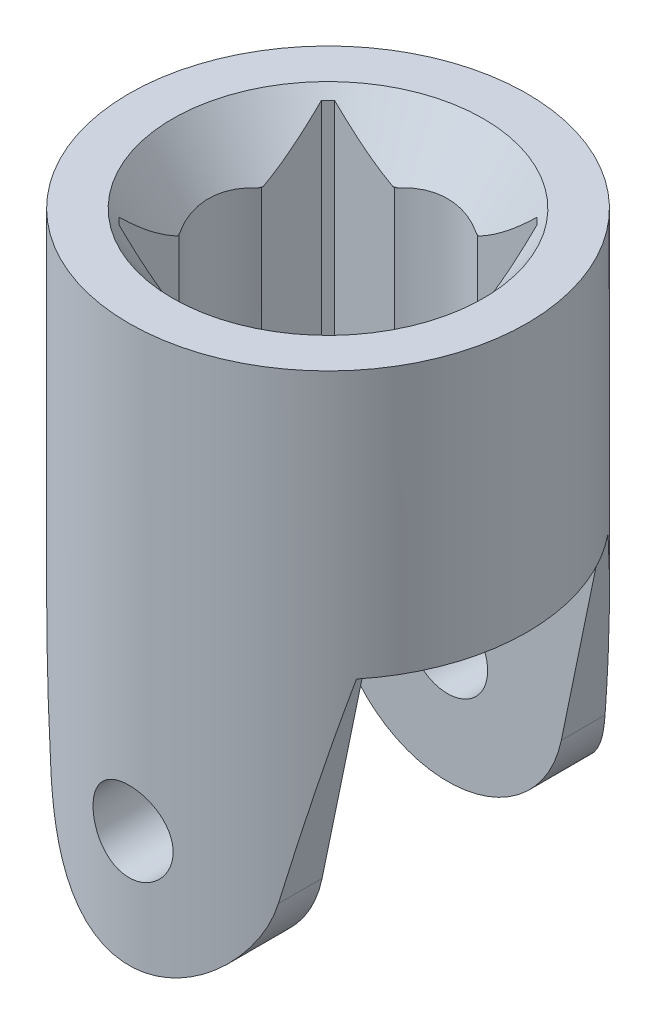
from build123d import *

# Parameters (mm, degrees)
SKETCH1_R           = 12
BOSS_EXTRUDE1_DEPTH = 33.53
CUT_EXTRUDE1_DEPTH  = 19.6
CHAMFER1_SIZE       = 0.4
SKETCH3_R           = 9.375
CUT_EXTRUDE2_DEPTH  = 3.4
CUT_EXTRUDE2_DRAFT  = -35
SKETCH4_W           = 24
SKETCH4_H           = 14.42225279
CUT_EXTRUDE3_DEPTH  = 17.4
SKETCH5_R           = 2.415
CUT_EXTRUDE4_DEPTH  = 33.7


with BuildPart() as part:
    # Sketch1 → Boss-Extrude1 (new body)
    with BuildSketch(Plane(origin=(0, 0, 0), x_dir=(1, 0, 0), z_dir=(0, 1, 0))):
        Circle(SKETCH1_R)
    extrude(amount=BOSS_EXTRUDE1_DEPTH)

    # Sketch2 → Cut-Extrude1 (cut)
    with BuildSketch(Plane(origin=(0, 33.53, 0), x_dir=(1, 0, 0), z_dir=(0, 1, 0))):
        with BuildLine():
            Line((-6.5, 6.5), (-2.5, 6.5))
            ThreePointArc((-2.5, 6.5), (0, 7.211126395), (2.5, 6.5))
            Line((2.5, 6.5), (6.5, 6.5))
            Line((6.5, 6.5), (6.5, 2.5))
            ThreePointArc((6.5, 2.5), (7.211126395, 0), (6.5, -2.5))
            Line((6.5, -2.5), (6.5, -6.5))
            Line((6.5, -6.5), (2.5, -6.5))
            ThreePointArc((2.5, -6.5), (0, -7.211126395), (-2.5, -6.5))
            Line((-2.5, -6.5), (-6.5, -6.5))
            Line((-6.5, -6.5), (-6.5, -2.5))
            ThreePointArc((-6.5, -2.5), (-7.211126395, 0), (-6.5, 2.5))
            Line((-6.5, 2.5), (-6.5, 6.5))
        make_face()
    extrude(amount=-CUT_EXTRUDE1_DEPTH, mode=Mode.SUBTRACT)

    # Chamfer1
    chamfer1_edges = [part.edges().sort_by_distance(p)[0] for p in [
        (-6.5, 23.73, 6.5),
        (6.5, 23.73, 6.5),
        (-6.5, 23.73, -6.5),
        (6.5, 23.73, -6.5),
    ]]
    chamfer(chamfer1_edges, length=CHAMFER1_SIZE)


with BuildPart() as cut_extrude2_tool:
    # Sketch3 → Cut-Extrude2 (with draft: the straight prism first)
    with BuildSketch(Plane(origin=(0, 33.53, 0), x_dir=(1, 0, 0), z_dir=(0, 1, 0))):
        Circle(SKETCH3_R)
    extrude(amount=-CUT_EXTRUDE2_DEPTH)
    # Cut-Extrude2: the draft: its side faces are tilted about the plane it starts from
    cut_extrude2_sides = [cut_extrude2_tool.faces().sort_by_distance(p)[0] for p in [
        (-9.375, 31.83, 0),
    ]]
    draft(cut_extrude2_sides, Plane(origin=(0, 33.53, 0), x_dir=(1, 0, 0), z_dir=(0, 1, 0)), CUT_EXTRUDE2_DRAFT)


with BuildPart() as part_1:
    add(part.part)

    # Cut-Extrude2: cut by cut_extrude2_tool
    add(cut_extrude2_tool.part, mode=Mode.SUBTRACT)

    # Sketch4 → Cut-Extrude3 (cut)
    with BuildSketch(Plane.XZ):
        Rectangle(SKETCH4_W, SKETCH4_H)
    extrude(amount=-CUT_EXTRUDE3_DEPTH, mode=Mode.SUBTRACT)

    # Sketch5 → Cut-Extrude4 (cut, symmetric)
    with BuildSketch(Plane.XY):
        with BuildLine():
            Line((12, -3.192277431), (12, 17.4))
            Line((12, 17.4), (9.3, 17.4))
            Line((9.3, 17.4), (6.854820161, 5.581747356))
            ThreePointArc((6.854820161, 5.581747356), (0, 0), (-6.854820161, 5.581747356))
            Line((-6.854820161, 5.581747356), (-9.3, 17.4))
            Line((-9.3, 17.4), (-12, 17.4))
            Line((-12, 17.4), (-12, -3.192277431))
            Line((-12, -3.192277431), (12, -3.192277431))
        make_face()
        with Locations((0, 7)):
            Circle(SKETCH5_R)
    extrude(amount=CUT_EXTRUDE4_DEPTH, both=True, mode=Mode.SUBTRACT)


solid = part_1.part
